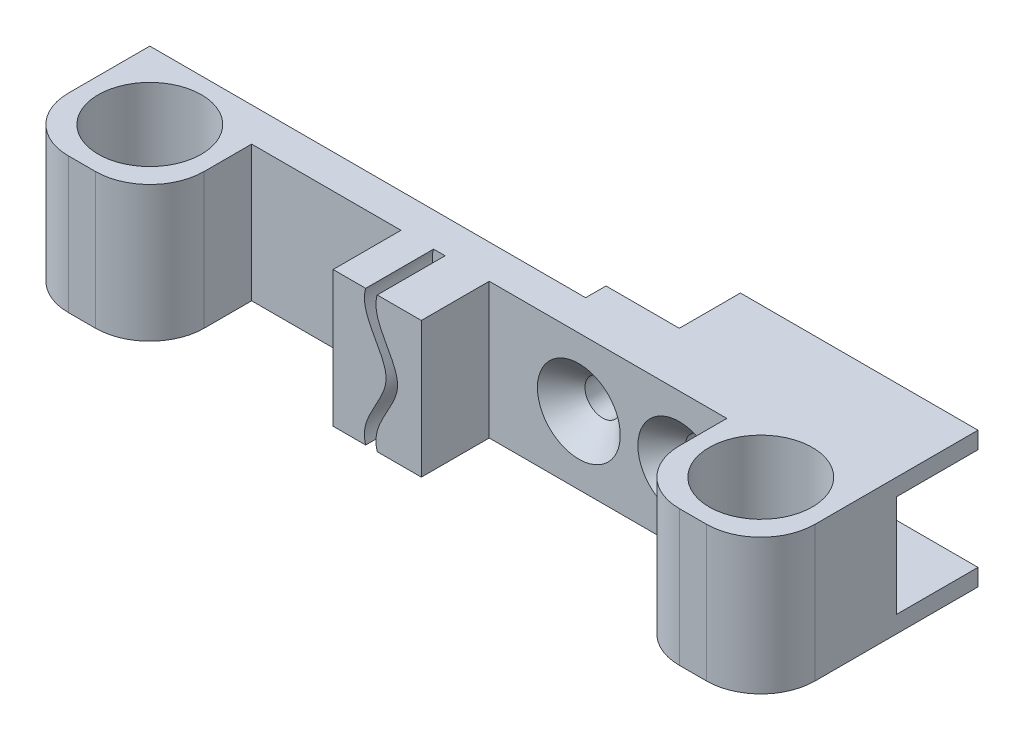
from build123d import *

# Parameters (mm, degrees)
ESQUISSE1_R                  = 7.6
BOSS_EXTRU_1_DEPTH           = 20
ESQUISSE8_W                  = 22.8
ESQUISSE8_H                  = 20
BOSS_EXTRU_4_DEPTH           = 3
ESQUISSE2_W                  = 35
ESQUISSE2_H                  = 2.5
BOSS_EXTRU_2_DEPTH           = 12
ENL_V_MAT_EXTRU_1_DEPTH      = 3
ENL_V_MAT_EXTRU_1_DEPTH_BACK = 22
ESQUISSE3_R                  = 2.6
CHANFREIN1_SIZE              = 3.5
ESQUISSE4_W                  = 10
ESQUISSE4_H                  = 20
BOSS_EXTRU_3_DEPTH           = 13
ENL_V_MAT_EXTRU_2_DEPTH      = 10


with BuildPart() as part:
    # Esquisse1 → Boss.-Extru.1 (new body)
    with BuildSketch(Plane(origin=(0, 0, 0), x_dir=(1, 0, 0), z_dir=(0, 1, 0))):
        with BuildLine():
            Line((47, -20), (43, -20))
            ThreePointArc((43, -20), (37.343145751, -17.656854249), (35, -12))
            Line((35, -12), (35, -5))
            Line((35, -5), (-35, -5))
            Line((-35, -5), (-35, -12))
            ThreePointArc((-35, -12), (-37.343145751, -17.656854249), (-43, -20))
            Line((-43, -20), (-47, -20))
            ThreePointArc((-47, -20), (-52.656854249, -17.656854249), (-55, -12))
            Line((-55, -12), (-55, 0))
            Line((-55, 0), (55, 0))
            Line((55, 0), (55, -12))
            ThreePointArc((55, -12), (52.656854249, -17.656854249), (47, -20))
        make_face()
        with Locations((45, -10)):
            Circle(ESQUISSE1_R, mode=Mode.SUBTRACT)
        with Locations((-45, -10)):
            Circle(ESQUISSE1_R, mode=Mode.SUBTRACT)
    extrude(amount=BOSS_EXTRU_1_DEPTH)

    # Esquisse8 → Boss.-Extru.4 (add)
    with BuildSketch(Plane(origin=(0, 0, 0), x_dir=(-1, 0, 0), z_dir=(0, 0, -1))):
        with Locations((-20.6, 10)):
            Rectangle(ESQUISSE8_W, ESQUISSE8_H)
    extrude(amount=BOSS_EXTRU_4_DEPTH)

    # Esquisse2 → Boss.-Extru.2 (add)
    with BuildSketch(Plane(origin=(0, 0, 0), x_dir=(-1, 0, 0), z_dir=(0, 0, -1))):
        with Locations((-37.5, 18.75)):
            Rectangle(ESQUISSE2_W, ESQUISSE2_H)
        with Locations((-37.5, 1.25)):
            Rectangle(ESQUISSE2_W, ESQUISSE2_H)
    extrude(amount=BOSS_EXTRU_2_DEPTH)

    # Esquisse3 → Enlèv. mat.-Extru.1 (cut, two sides: drawn at the far end of the back side and taken through both)
    with BuildSketch(Plane(origin=(0, 0, 0), x_dir=(-1, 0, 0), z_dir=(0, 0, -1)).offset(-ENL_V_MAT_EXTRU_1_DEPTH_BACK)):
        with Locations((-13.2, 10)):
            Circle(ESQUISSE3_R)
        with Locations((-28, 10)):
            Circle(ESQUISSE3_R)
    extrude(amount=ENL_V_MAT_EXTRU_1_DEPTH + ENL_V_MAT_EXTRU_1_DEPTH_BACK, mode=Mode.SUBTRACT)

    # Chanfrein1
    chanfrein1_edges = [part.edges().sort_by_distance(p)[0] for p in [
        (30.6, 10, 5),
        (15.8, 10, 5),
    ]]
    chamfer(chanfrein1_edges, length=CHANFREIN1_SIZE)

    # Esquisse4 → Boss.-Extru.3 (add)
    with BuildSketch(Plane(origin=(0, 0, 0), x_dir=(0, 0, -1), z_dir=(1, 0, 0))):
        with Locations((-10, 10)):
            Rectangle(ESQUISSE4_W, ESQUISSE4_H)
    extrude(amount=-BOSS_EXTRU_3_DEPTH)

    # Esquisse7 → Enlèv. mat.-Extru.2 (cut)
    with BuildSketch(Plane.XY.offset(15)):
        with BuildLine():
            Line((-8.2, 20), (-6.5, 20))
            add(Edge.make_bspline(
                [(-6.5, 20), (-7.602205078, 16.366247775), (0.602205078, 10), (-7.602205078, 3.633752225), (-6.5, 0)],
                knots=[0, 0, 0, 0, 0.5, 1, 1, 1, 1], degree=3))
            Line((-6.5, 0), (-8.2, 0))
            add(Edge.make_bspline(
                [(-8.2, 20), (-9.302205078, 16.366247775), (-1.097794922, 10), (-9.302205078, 3.633752225), (-8.2, 0)],
                knots=[0, 0, 0, 0, 0.5, 1, 1, 1, 1], degree=3))
        make_face()
    extrude(amount=-ENL_V_MAT_EXTRU_2_DEPTH, mode=Mode.SUBTRACT)


solid = part.part
